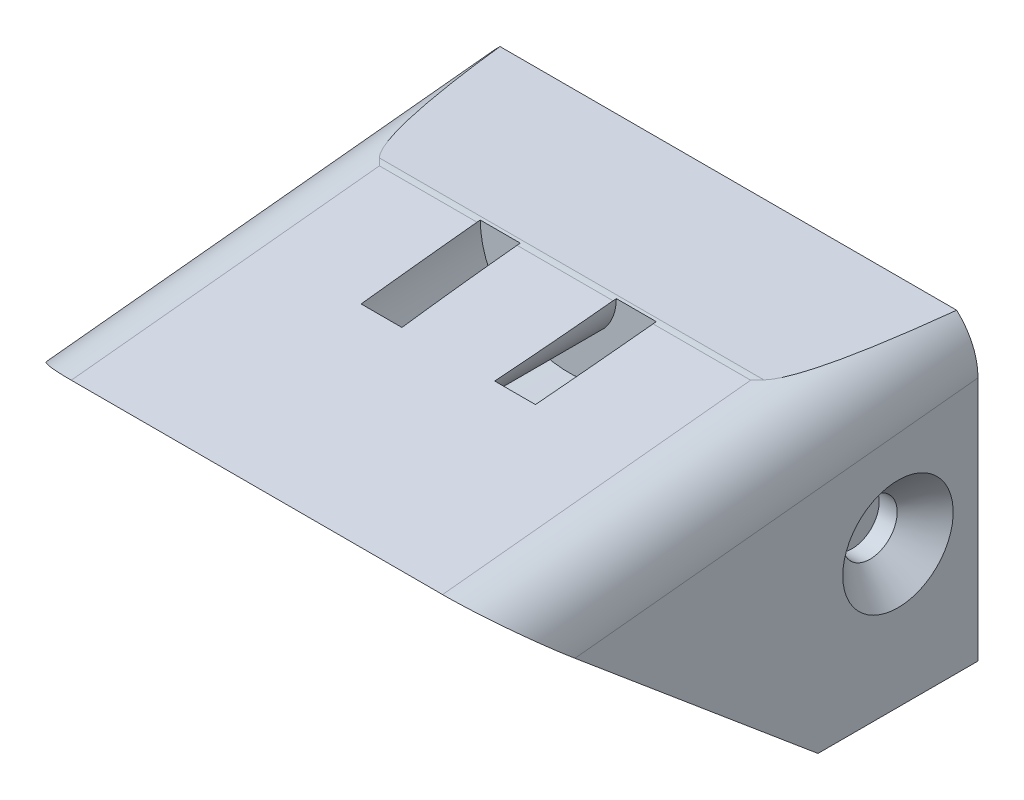
from build123d import *

# Parameters (mm, degrees)
BOSS_EXTRUDE1_DEPTH = 31.2
BOSS_EXTRUDE2_DEPTH = 10
CUT_EXTRUDE1_START  = -31.2
SKETCH6_R           = 1.6999999999999995
CUT_EXTRUDE1_DEPTH  = 31.2
CUT_EXTRUDE2_DEPTH  = 3.25
CHAMFER1_SIZE       = 1.75
FILLET2_R           = 4
CUT_EXTRUDE3_DEPTH  = 7.5


with BuildPart() as part:
    # Sketch4 → Boss-Extrude1 (new body)
    with BuildSketch(Plane(origin=(15.600000000000225, 5.91e-15, 1.0893e-13), x_dir=(3.8e-16, -1, 0), z_dir=(-1, -3.8e-16, -6.98e-15))):
        Polygon((12.836171405416206, 32.32337770791894), (-3.4906338806220005, 51.78090656314089), (-5.485895724995086, 32.32337770791894), align=None)
    extrude(amount=BOSS_EXTRUDE1_DEPTH)

    # Sketch5 → Boss-Extrude2 (add)
    with BuildSketch(Plane(origin=(-2.2571e-13, 0, 32.323377707918944), x_dir=(-1, 0, -6.98e-15), z_dir=(6.98e-15, 0, -1))):
        Polygon((-15.600000000000223, 5.485895724995093), (-15.60000000000023, -12.8361714054162), (15.599999999999769, -12.836171405416213), (15.599999999999776, 5.485895724995081), align=None)
        Polygon((-12.725000000000225, -11.125000000000004), (-9.475000000000225, -11.125000000000004), (-9.475000000000227, 3.1250000000000013), (-12.725000000000227, 3.125000000000001), align=None, mode=Mode.SUBTRACT)
        Polygon((12.724999999999774, -11.125000000000002), (9.474999999999774, -11.125), (9.474999999999772, 3.1250000000000018), (12.724999999999772, 3.1250000000000027), align=None, mode=Mode.SUBTRACT)
    extrude(amount=BOSS_EXTRUDE2_DEPTH)

    # Sketch6 → Cut-Extrude1 (cut)
    with BuildSketch(Plane(origin=(15.600000000000225, 5.91e-15, 1.0909e-13), x_dir=(6.99e-15, 0, -1), z_dir=(1, 3.8e-16, 6.99e-15)).offset(CUT_EXTRUDE1_START)):
        with Locations((-27.32337770791874, -4.000000000000007)):
            Circle(SKETCH6_R)
    extrude(amount=CUT_EXTRUDE1_DEPTH, mode=Mode.SUBTRACT)

    # Sketch8 → Cut-Extrude2 (cut)
    with BuildSketch(Plane(origin=(9.475000000000227, -1.15e-15, 6.616e-14), x_dir=(6.98e-15, 0, -1), z_dir=(1, 0, 6.98e-15))):
        Polygon((-32.323377707918944, -11.125000000000002), (-32.323377707918944, 3.1250000000000027), (-39.44837770791897, -3.999999999999999), align=None)
    cut_extrude2 = extrude(amount=CUT_EXTRUDE2_DEPTH, mode=Mode.SUBTRACT)

    # Chamfer1
    chamfer1_edges = [part.edges().sort_by_distance(p)[0] for p in [
        (-15.599999999999975, -4.000000000000013, 29.02337770791863),
        (15.600000000000025, -4.000000000000001, 29.02337770791885),
    ]]
    chamfer(chamfer1_edges, length=CHAMFER1_SIZE)

    # Mirror1: Cut-Extrude2 across plane
    add(cut_extrude2.mirror(Plane(origin=(0, 0, 0), x_dir=(0, 0, 1), z_dir=(1, 0, 0))), mode=Mode.SUBTRACT)

    # Fillet2
    # the kernel refuses this fillet: 4 mm, written as the material it takes off along each edge
    with BuildSketch(Plane(origin=(-15.600000000000204, 2.4705385648813603, 61.72874077701889), x_dir=(1, 3.9e-16, 6.98e-15), z_dir=(6.907902673272719e-15, 0.10200953157406341, -0.9947834213878116))) as fillet2_piece_1:
        with BuildLine():
            CenterArc((FILLET2_R, FILLET2_R), FILLET2_R, 180, 90)
            Line((2.72e-15, FILLET2_R), (0, 0))
            Line((0, 0), (FILLET2_R, 0))
        make_face()
    extrude(amount=39.55956285246186, mode=Mode.SUBTRACT)
    with BuildSketch(Plane(origin=(16.11138148873873, 5.485895724995093, 32.323377707919036), x_dir=(-6.90790267327272e-15, -0.10200953157406191, 0.9947834213878117), z_dir=(-1, -3.8e-16, -6.98e-15))) as fillet2_piece_2:
        with BuildLine():
            CenterArc((FILLET2_R * 0.0511381488739, -FILLET2_R), FILLET2_R, 89.9999999999999, 5.854900023063593)
            Line((-FILLET2_R * 0.0508713827002, -FILLET2_R * 0.00521657861219), (0, 0))
            Line((0, 0), (FILLET2_R * 0.0511381488739, 0))
        make_face()
    extrude(amount=32.22276297747746, mode=Mode.SUBTRACT)
    with BuildSketch(Plane(origin=(15.599999999999794, 2.470538564881372, 61.72874077701911), x_dir=(0, -0.9947834213878115, -0.1020095315740634), z_dir=(6.907902673272719e-15, 0.10200953157406341, -0.9947834213878116))) as fillet2_piece_3:
        with BuildLine():
            CenterArc((FILLET2_R, FILLET2_R), FILLET2_R, 180, 90)
            Line((6.7e-16, FILLET2_R), (0, 0))
            Line((0, 0), (FILLET2_R, 0))
        make_face()
    extrude(amount=39.559562852461866, mode=Mode.SUBTRACT)

    # Sketch9 → Cut-Extrude3 (cut)
    with BuildSketch(Plane.XY.offset(32.32337770791894)):
        with BuildLine():
            Line((3, 5.485895724995084), (5.5, 5.485895724995082))
            ThreePointArc((5.5, 5.485895724995082), (-1.4e-15, -0.01410427500491185), (-5.5, 5.485895724995082))
            Line((-5.5, 5.485895724995082), (-3, 5.485895724995084))
            ThreePointArc((-3, 5.485895724995084), (-1.55e-15, 2.485895724995088), (3, 5.485895724995084))
        make_face()
    extrude(amount=CUT_EXTRUDE3_DEPTH, mode=Mode.SUBTRACT)


solid = part.part
